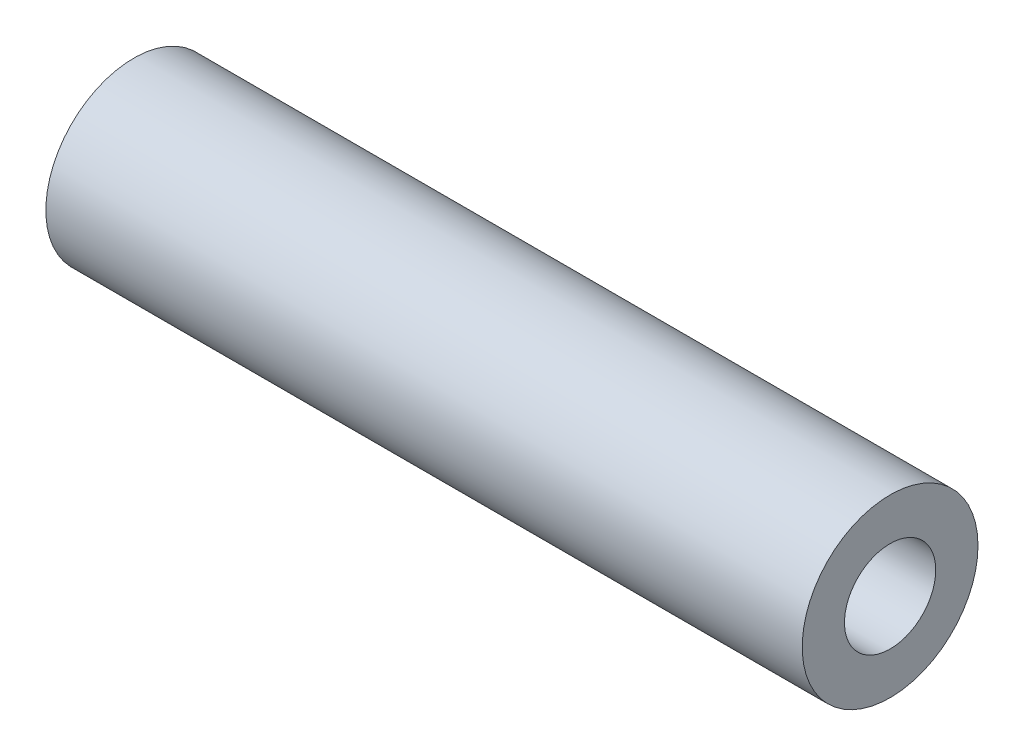
from build123d import *

# Parameters (mm, degrees)
SKETCH1_R           = 42.799
SKETCH1_R_2         = 22.225
BOSS_EXTRUDE1_DEPTH = 368.3


with BuildPart() as part:
    # Sketch1 → Boss-Extrude1 (new body)
    with BuildSketch(Plane(origin=(0, 0, 0), x_dir=(0, 0, -1), z_dir=(1, 0, 0))):
        Circle(SKETCH1_R)
        Circle(SKETCH1_R_2, mode=Mode.SUBTRACT)
    extrude(amount=BOSS_EXTRUDE1_DEPTH)


solid = part.part
